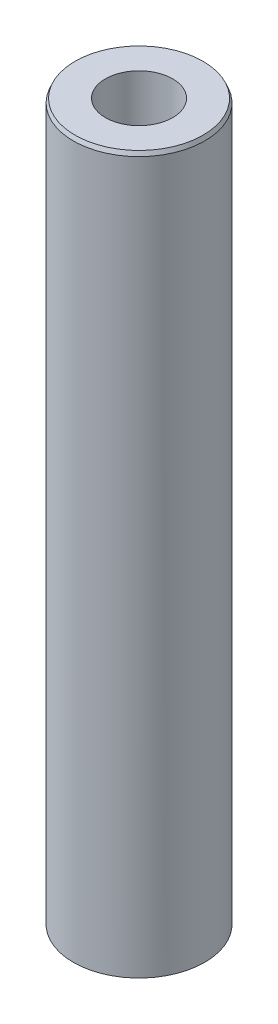
from build123d import *
from OCP.BRepFilletAPI import BRepFilletAPI_MakeChamfer

# Parameters (mm, degrees)
SKETCH1_R           = 55
BOSS_EXTRUDE1_DEPTH = 600
SKETCH2_R           = 28.139076434
CUT_EXTRUDE1_DEPTH  = 606.020660804
CHAMFER1_SIZE       = 3.438396573
CHAMFER1_SIZE2      = 1.44030876


with BuildPart() as part:
    # Sketch1 → Boss-Extrude1 (new body)
    with BuildSketch(Plane(origin=(0, 0, 0), x_dir=(1, 0, 0), z_dir=(0, 1, 0))):
        Circle(SKETCH1_R)
    extrude(amount=BOSS_EXTRUDE1_DEPTH)

    # Sketch2 → Cut-Extrude1 (cut, through all)
    with BuildSketch(Plane(origin=(0, 0, 0), x_dir=(1, 0, 0), z_dir=(0, 1, 0))):
        Circle(SKETCH2_R)
    extrude(amount=CUT_EXTRUDE1_DEPTH, mode=Mode.SUBTRACT)

    # Chamfer1: one chamfer whose edges measure the first distance from different faces: ONE call of the kernel's chamfer builder (chamfer() names one face for all edges)
    chamfer1_edges_1 = [part.edges().sort_by_distance(p)[0] for p in [
        (-55, 600, 0),
    ]]
    chamfer1_side_1 = [part.faces().sort_by_distance(p)[0] for p in [
        (-55, 300, 0),
    ]]
    chamfer1_edges_2 = [part.edges().sort_by_distance(p)[0] for p in [
        (-55, 0, 0),
    ]]
    chamfer1_side_2 = [part.faces().sort_by_distance(p)[0] for p in [
        (-53.444365081, 0, 0),
    ]]
    chamfer1 = BRepFilletAPI_MakeChamfer(part.part.solid().wrapped)
    for e in chamfer1_edges_1:
        chamfer1.Add(CHAMFER1_SIZE, CHAMFER1_SIZE2, e.wrapped, chamfer1_side_1[0].wrapped)  # the first distance lies on this face
    for e in chamfer1_edges_2:
        chamfer1.Add(CHAMFER1_SIZE, CHAMFER1_SIZE2, e.wrapped, chamfer1_side_2[0].wrapped)  # the first distance lies on this face
    add(Compound.cast(chamfer1.Shape()), mode=Mode.REPLACE)


solid = part.part
